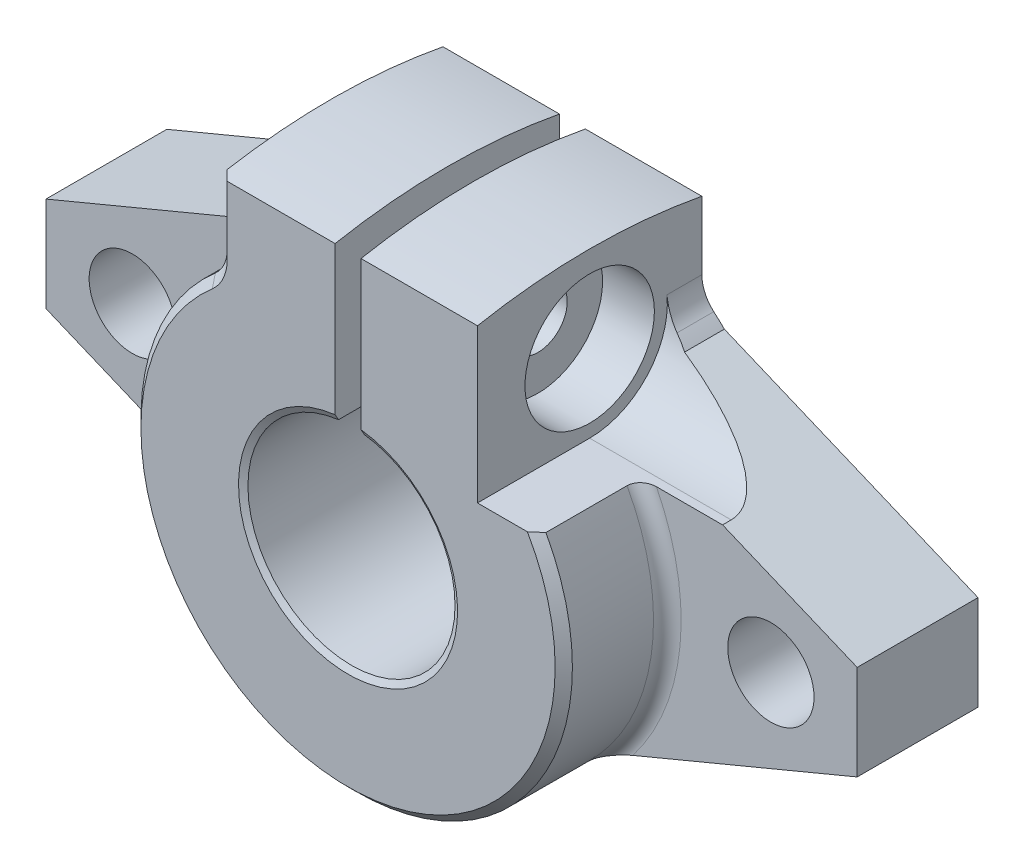
from build123d import *

# Parameters (mm, degrees)
BOSS_EXTRUDE1_DEPTH                                 = 13
CUT_EXTRUDE1_DEPTH                                  = 24.780243901
CUT_EXTRUDE1_DEPTH_BACK                             = 24.780243901
FILLET1_R                                           = 2
BOSS_EXTRUDE2_DEPTH                                 = 7
HOLE_WIZARD_5_0_5_1_D                               = 5
HOLE_WIZARD_5_0_5_1_DEPTH                           = 10
HOLE_WIZARD_5_0_5_1_TIP                             = 1.502151548
CUT_EXTRUDE2_REACH                                  = 39.017
CBORE_FOR_M4_HEX_SOCKET_HEAD_CAP_SCREW3_D           = 3.4
CBORE_FOR_M4_HEX_SOCKET_HEAD_CAP_SCREW3_CBORE_D     = 7.5
CBORE_FOR_M4_HEX_SOCKET_HEAD_CAP_SCREW3_CBORE_DEPTH = 3
CHAMFER2_SIZE                                       = 0.5
FILLET2_R                                           = 0.8
CHAMFER3_SIZE                                       = 0.2
CHAMFER3_SIZE2                                      = 0.346410162


with BuildPart() as part:
    # Sketch1 → Boss-Extrude1 (new body)
    with BuildSketch(Plane.XY):
        with BuildLine():
            Line((0.75, 5.95294045), (0.75, 15.5))
            Line((0.75, 15.5), (7.5, 15.5))
            Line((7.5, 15.5), (7.5, 10))
            ThreePointArc((7.5, 10), (0, -12.5), (-7.5, 10))
            Line((-7.5, 10), (-7.5, 15.5))
            Line((-7.5, 15.5), (-0.75, 15.5))
            Line((-0.75, 15.5), (-0.75, 5.95294045))
            ThreePointArc((-0.75, 5.95294045), (0, -6), (0.75, 5.95294045))
        make_face()
    extrude(amount=BOSS_EXTRUDE1_DEPTH)

    # Sketch2 → Cut-Extrude1 (cut, two sides: drawn at the far end of the back side and taken through both)
    with BuildSketch(Plane(origin=(0, 0, 0), x_dir=(0, 0, -1), z_dir=(1, 0, 0)).offset(-CUT_EXTRUDE1_DEPTH_BACK)):
        with BuildLine():
            Line((69.410215856, 1.772448509), (0, 14.891132578))
            ThreePointArc((0, 14.891132578), (-6.5, 15.5), (-13, 14.891132578))
            Line((-13, 14.891132578), (-82.410215856, 1.772448509))
            Line((-82.410215856, 1.772448509), (-82.410215856, 143.050584636))
            Line((-82.410215856, 143.050584636), (69.410215856, 143.050584636))
            Line((69.410215856, 143.050584636), (69.410215856, 1.772448509))
        make_face()
    extrude(amount=CUT_EXTRUDE1_DEPTH + CUT_EXTRUDE1_DEPTH_BACK, mode=Mode.SUBTRACT)

    # Fillet1
    fillet1_edges = [part.edges().sort_by_distance(p)[0] for p in [
        (-7.5, 10, 6.5),
        (7.5, 10, 6.5),
    ]]
    fillet(fillet1_edges, radius=FILLET1_R)

    # Sketch3 → Boss-Extrude2 (add)
    with BuildSketch(Plane.XY):
        with BuildLine():
            Line((8.803538255, 8.873990883), (23.5, 2.75))
            Line((23.5, 2.75), (23.5, -2.75))
            Line((23.5, -2.75), (8.803538255, -8.873990883))
            ThreePointArc((8.803538255, -8.873990883), (12.5, 0), (8.803538255, 8.873990883))
        make_face()
    extrude(amount=BOSS_EXTRUDE2_DEPTH)

    # Mirror1: part across plane


with BuildPart() as part_1:
    add(part.part)
    add(part.part.mirror(Plane(origin=(0, 0, 0), x_dir=(0, 0, 1), z_dir=(1, 0, 0))))

    # Диаметр отверстия Ø5.0 (5)1
    with Locations(Plane.XY.offset(7)):
        with Locations((18.5, 0), (-18.5, 0)):
            Hole(HOLE_WIZARD_5_0_5_1_D / 2, depth=HOLE_WIZARD_5_0_5_1_DEPTH)
            with Locations((0, 0, -(HOLE_WIZARD_5_0_5_1_DEPTH + HOLE_WIZARD_5_0_5_1_TIP / 2))):  # 118° drill point
                Cone(0, HOLE_WIZARD_5_0_5_1_D / 2, HOLE_WIZARD_5_0_5_1_TIP, mode=Mode.SUBTRACT)

    # Sketch9 → Cut-Extrude2 (cut, up to next)
    with BuildSketch(Plane(origin=(7.5, 0, 0), x_dir=(0, 0, -1), z_dir=(1, 0, 0)), mode=Mode.PRIVATE) as cut_extrude2_sk1:
        with BuildLine():
            Line((-2.023006126, 10.95445115), (-13, 10.95445115))
            Line((-13, 10.95445115), (-13, 6))
            Line((-13, 6), (-6.5, 6))
            ThreePointArc((-6.5, 6), (-3.161210536, 7.482967532), (-2.023006126, 10.95445115))
        make_face()
    cut_extrude2_tool1 = extrude(cut_extrude2_sk1.sketch, amount=CUT_EXTRUDE2_REACH, mode=Mode.PRIVATE) & part_1.part
    add(cut_extrude2_tool1.solids().sort_by_distance((7.5, 8.604622, 7.889878))[0], mode=Mode.SUBTRACT)

    # CBORE for M4 Hex Socket Head Cap Screw3 (through all)
    with Locations(Plane(origin=(7.5, 0, 0), x_dir=(0, 0, -1), z_dir=(1, 0, 0))):
        with Locations((-6.5, 10.5)):
            CounterBoreHole(CBORE_FOR_M4_HEX_SOCKET_HEAD_CAP_SCREW3_D / 2, CBORE_FOR_M4_HEX_SOCKET_HEAD_CAP_SCREW3_CBORE_D / 2, CBORE_FOR_M4_HEX_SOCKET_HEAD_CAP_SCREW3_CBORE_DEPTH)

    # Chamfer2
    chamfer2_edges = [part_1.edges().sort_by_distance(p)[0] for p in [
        (-7.5, 12.922791864, 13),
        (-7.680564695, 10.123996352, 13),
        (-2.211613172, -12.302795096, 13),
    ]]
    chamfer(chamfer2_edges, length=CHAMFER2_SIZE)

    # Fillet2
    fillet2_edges = [part_1.edges().sort_by_distance(p)[0] for p in [
        (-12.5, 0, 7),
        (8.803538255, -8.873990883, 3.5),
        (-8.803538255, -8.873990883, 3.5),
        (12.36996926, -1.798293779, 7),
    ]]
    fillet(fillet2_edges, radius=FILLET2_R)

    # Chamfer3
    chamfer3_edges = [part_1.edges().sort_by_distance(p)[0] for p in [
        (0, -6, 13),
    ]]
    chamfer3_side = [part_1.faces().sort_by_distance(p)[0] for p in [
        (0, -6, 6.5),
    ]]
    chamfer(chamfer3_edges, length=CHAMFER3_SIZE, length2=CHAMFER3_SIZE2, reference=chamfer3_side[0])


solid = part_1.part
